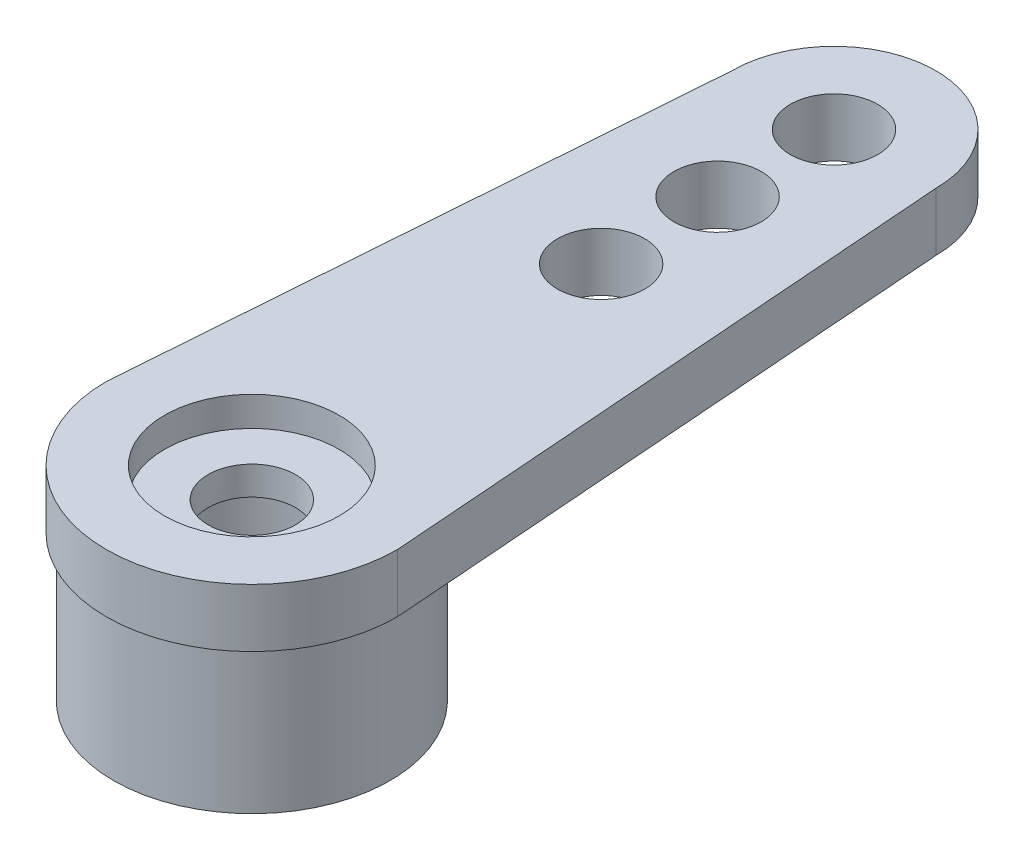
from build123d import *

# Parameters (mm, degrees)
BOSS_EXTRUDE1_DEPTH = 2
SKETCH2_R           = 1.5
CUT_EXTRUDE1_DEPTH  = 25.109126902
SKETCH7_R           = 4.75
BOSS_EXTRUDE2_DEPTH = 5
SKETCH3_R           = 1.5
CUT_EXTRUDE2_DEPTH  = 26.024987512
SKETCH4_R           = 3
CUT_EXTRUDE3_DEPTH  = 1.016
SKETCH6_R           = 1.5
CUT_EXTRUDE4_DEPTH  = 26.024987512
SKETCH5_R           = 1.5
CUT_EXTRUDE5_DEPTH  = 26.024987512
CUT_EXTRUDE6_START  = -5
SKETCH8_R           = 3
CUT_EXTRUDE6_DEPTH  = 5


with BuildPart() as part:
    # Sketch1 → Boss-Extrude1 (new body)
    with BuildSketch(Plane(origin=(0, 0, 0), x_dir=(1, 0, 0), z_dir=(0, 1, 0))):
        with BuildLine():
            Line((3.5, 20), (5, 0))
            ThreePointArc((5, 0), (0, -5), (-5, 0))
            Line((-5, 0), (-3.5, 20))
            ThreePointArc((-3.5, 20), (0, 23.5), (3.5, 20))
        make_face()
    extrude(amount=BOSS_EXTRUDE1_DEPTH)

    # Sketch2 → Cut-Extrude1 (cut, through all)
    with BuildSketch(Plane(origin=(0, 2, 0), x_dir=(1, 0, 0), z_dir=(0, 1, 0))):
        with Locations((0, 20)):
            Circle(SKETCH2_R)
    extrude(amount=-CUT_EXTRUDE1_DEPTH, mode=Mode.SUBTRACT)

    # Sketch7 → Boss-Extrude2 (add)
    with BuildSketch(Plane(origin=(0, 0, 0), x_dir=(-1, 0, 0), z_dir=(0, -1, 0))):
        Circle(SKETCH7_R)
    extrude(amount=BOSS_EXTRUDE2_DEPTH)

    # Sketch3 → Cut-Extrude2 (cut, through all)
    with BuildSketch(Plane(origin=(0, 2, 0), x_dir=(1, 0, 0), z_dir=(0, 1, 0))):
        Circle(SKETCH3_R)
    extrude(amount=-CUT_EXTRUDE2_DEPTH, mode=Mode.SUBTRACT)

    # Sketch4 → Cut-Extrude3 (cut)
    with BuildSketch(Plane(origin=(0, 2, 0), x_dir=(1, 0, 0), z_dir=(0, 1, 0))):
        Circle(SKETCH4_R)
    extrude(amount=-CUT_EXTRUDE3_DEPTH, mode=Mode.SUBTRACT)

    # Sketch6 → Cut-Extrude4 (cut, through all)
    with BuildSketch(Plane(origin=(0, 2, 0), x_dir=(1, 0, 0), z_dir=(0, 1, 0))):
        with Locations((0, 16)):
            Circle(SKETCH6_R)
    extrude(amount=-CUT_EXTRUDE4_DEPTH, mode=Mode.SUBTRACT)

    # Sketch5 → Cut-Extrude5 (cut, through all)
    with BuildSketch(Plane(origin=(0, 2, 0), x_dir=(1, 0, 0), z_dir=(0, 1, 0))):
        with Locations((0, 12)):
            Circle(SKETCH5_R)
    extrude(amount=-CUT_EXTRUDE5_DEPTH, mode=Mode.SUBTRACT)

    # Sketch8 → Cut-Extrude6 (cut)
    with BuildSketch(Plane(origin=(0, -5, 0), x_dir=(-1, 0, 0), z_dir=(0, -1, 0)).offset(CUT_EXTRUDE6_START)):
        Circle(SKETCH8_R)
    extrude(amount=CUT_EXTRUDE6_DEPTH, mode=Mode.SUBTRACT)


solid = part.part
